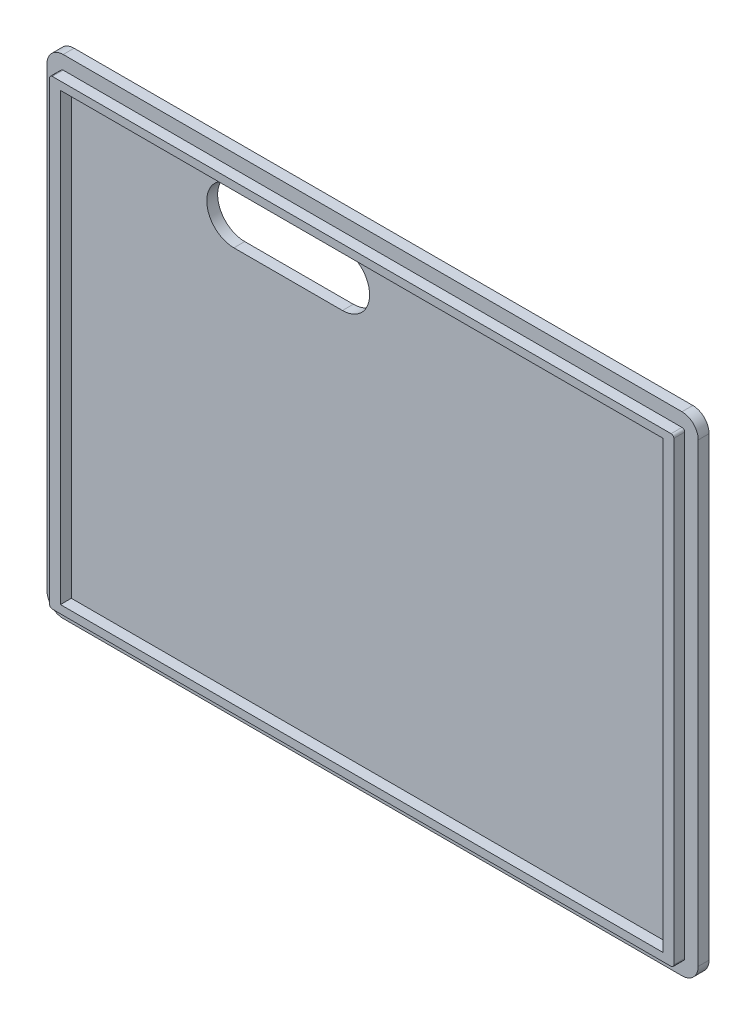
from build123d import *

# Parameters (mm, degrees)
ESQUISSE1_W             = 120
ESQUISSE1_H             = 90
BOSS_EXTRU_1_DEPTH      = 2
ESQUISSE2_W             = 115
ESQUISSE2_H             = 85
ESQUISSE2_W_2           = 111
ESQUISSE2_H_2           = 82.04347826
BOSS_EXTRU_2_DEPTH      = 2
ENL_V_MAT_EXTRU_1_DEPTH = 2
CONG_1_R                = 3
CONG_2_R                = 0.5


with BuildPart() as part:
    # Esquisse1 → Boss.-Extru.1 (new body)
    with BuildSketch(Plane.XY):
        Rectangle(ESQUISSE1_W, ESQUISSE1_H)
    extrude(amount=BOSS_EXTRU_1_DEPTH)

    # Esquisse2 → Boss.-Extru.2 (add)
    with BuildSketch(Plane.XY.offset(2)):
        Rectangle(ESQUISSE2_W, ESQUISSE2_H)
        Rectangle(ESQUISSE2_W_2, ESQUISSE2_H_2, mode=Mode.SUBTRACT)
    extrude(amount=BOSS_EXTRU_2_DEPTH)

    # Esquisse3 → Enlèv. mat.-Extru.1 (cut)
    with BuildSketch(Plane(origin=(0, 0, 0), x_dir=(-1, 0, 0), z_dir=(0, 0, -1))):
        with BuildLine():
            Line((5.548380707, 39.874958244), (25.548380707, 39.874958244))
            ThreePointArc((25.548380707, 39.874958244), (30.548380707, 34.874958244), (25.548380707, 29.874958244))
            Line((25.548380707, 29.874958244), (5.548380707, 29.874958244))
            ThreePointArc((5.548380707, 29.874958244), (0.548380707, 34.874958244), (5.548380707, 39.874958244))
        make_face()
    extrude(amount=-ENL_V_MAT_EXTRU_1_DEPTH, mode=Mode.SUBTRACT)

    # Congé1
    cong_1_edges = [part.edges().sort_by_distance(p)[0] for p in [
        (60, 45, 1),
        (-60, -45, 1),
        (-60, 45, 1),
        (60, -45, 1),
    ]]
    fillet(cong_1_edges, radius=CONG_1_R)

    # Congé2
    cong_2_edges = [part.edges().sort_by_distance(p)[0] for p in [
        (57.5, -42.5, 3),
        (57.5, 42.5, 3),
        (-57.5, 42.5, 3),
        (-57.5, -42.5, 3),
    ]]
    fillet(cong_2_edges, radius=CONG_2_R)


solid = part.part
